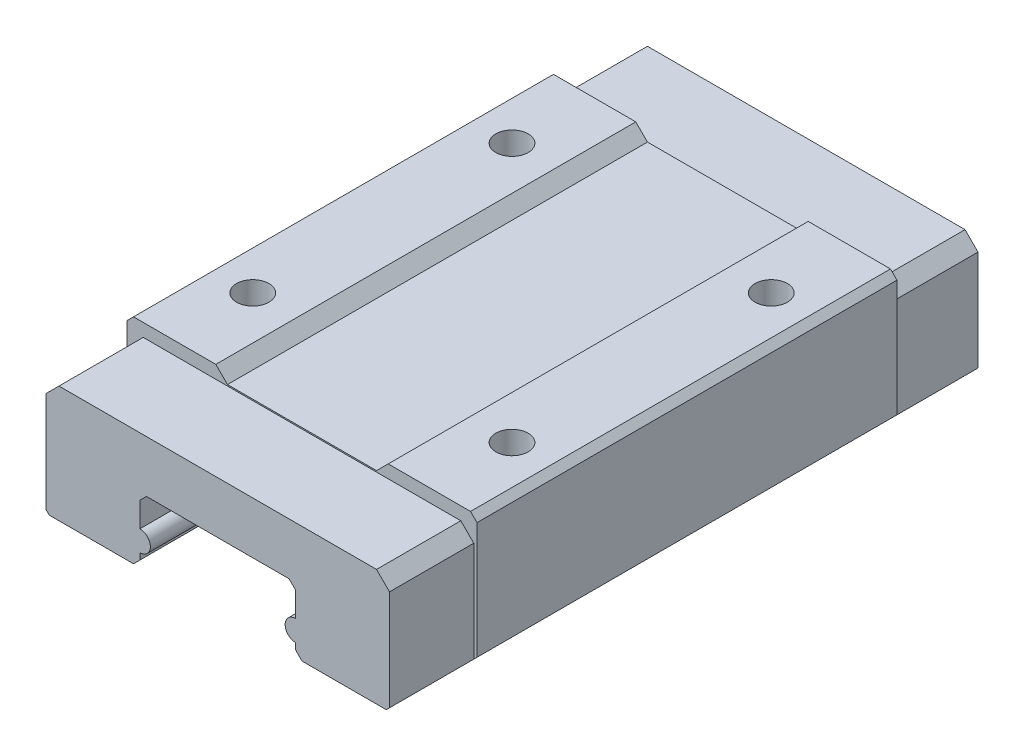
from build123d import *

# Parameters (mm, degrees)
MAINBLOCKSKETCH_W              = 26.5
MAINBLOCKSKETCH_H              = 45.4
MAINBLOCK_DEPTH                = 9
FACEDSURFACESKETCH_W           = 27
FACEDSURFACESKETCH_H           = 32.4
FACEDSURFACE_DEPTH             = 10
M3X0_5_TAPPED_HOLE1_D          = 2.5
M3X0_5_TAPPED_HOLE1_DEPTH      = 8.5
M3X0_5_TAPPED_HOLE1_TIP        = 0.751075774
RAIL_SLOT_DEPTH                = 29.240750698
RAIL_SLOT_DEPTH_BACK           = 29.240750698
INTERNAL_DIP_SKETCH_W          = 13.5
INTERNAL_DIP_SKETCH_H          = 32.4
INTERNAL_DIP_DEPTH             = 0.9
INTERNAL_CHAMFER_SIZE          = 0.5
COSMETIC_CHAMFERS_SIZE         = 1
SMALLER_COSMETIC_CHAMFERS_SIZE = 0.5


with BuildPart() as part:
    # MainBlockSketch → MainBlock (new body)
    with BuildSketch(Plane(origin=(0, 0, 0), x_dir=(1, 0, 0), z_dir=(0, 1, 0))):
        Rectangle(MAINBLOCKSKETCH_W, MAINBLOCKSKETCH_H)
    extrude(amount=MAINBLOCK_DEPTH)

    # FacedSurfaceSketch → FacedSurface (add)
    with BuildSketch(Plane(origin=(0, 0, 0), x_dir=(1, 0, 0), z_dir=(0, 1, 0))):
        Rectangle(FACEDSURFACESKETCH_W, FACEDSURFACESKETCH_H)
    extrude(amount=FACEDSURFACE_DEPTH)

    # M3x0.5 Tapped Hole1
    with Locations(Plane(origin=(0, 10, 0), x_dir=(1, 0, 0), z_dir=(0, 1, 0))):
        with Locations((-10, 10), (10, 10), (10, -10), (-10, -10)):
            Hole(M3X0_5_TAPPED_HOLE1_D / 2, depth=M3X0_5_TAPPED_HOLE1_DEPTH)
            with Locations((0, 0, -(M3X0_5_TAPPED_HOLE1_DEPTH + M3X0_5_TAPPED_HOLE1_TIP / 2))):  # 118° drill point
                Cone(0, M3X0_5_TAPPED_HOLE1_D / 2, M3X0_5_TAPPED_HOLE1_TIP, mode=Mode.SUBTRACT)

    # RailSlotSketch → Rail Slot (cut, two sides: drawn at the far end of the back side and taken through both)
    with BuildSketch(Plane.XY.offset(-RAIL_SLOT_DEPTH_BACK)):
        with BuildLine():
            Line((-6, 2.59), (-6, 5))
            Line((-6, 5), (6, 5))
            Line((6, 5), (6, 2.59))
            ThreePointArc((6, 2.59), (5.2, 1.79), (6, 0.99))
            Line((6, 0.99), (6, 0))
            Line((6, 0), (-6, 0))
            Line((-6, 0), (-6, 0.99))
            ThreePointArc((-6, 0.99), (-5.2, 1.79), (-6, 2.59))
        make_face()
    extrude(amount=RAIL_SLOT_DEPTH + RAIL_SLOT_DEPTH_BACK, mode=Mode.SUBTRACT)

    # Internal Dip Sketch → Internal Dip (cut)
    with BuildSketch(Plane(origin=(0, 10, 0), x_dir=(1, 0, 0), z_dir=(0, 1, 0))):
        Rectangle(INTERNAL_DIP_SKETCH_W, INTERNAL_DIP_SKETCH_H)
    extrude(amount=-INTERNAL_DIP_DEPTH, mode=Mode.SUBTRACT)

    # Internal Chamfer
    internal_chamfer_edges = [part.edges().sort_by_distance(p)[0] for p in [
        (6, 5, 0),
        (-6, 5, 0),
    ]]
    chamfer(internal_chamfer_edges, length=INTERNAL_CHAMFER_SIZE)

    # Cosmetic Chamfers
    # the kernel refuses this chamfer: 1 mm, written as the material it adds along each edge
    with BuildSketch(Plane(origin=(-6.75, 9.1, 16.2), x_dir=(0.9996219169112968, -0.027495876610585623, 0), z_dir=(0, 0, -1))) as cosmetic_chamfers_piece_1_section:
        Polygon((COSMETIC_CHAMFERS_SIZE * 0.999621916911, -COSMETIC_CHAMFERS_SIZE * 0.0274958766106), (-COSMETIC_CHAMFERS_SIZE * 0.0274958766106, -COSMETIC_CHAMFERS_SIZE * 0.999621916911), (0, 0), align=None)
    cosmetic_chamfers_piece_1 = extrude(amount=32.4, mode=Mode.PRIVATE)
    cosmetic_chamfers_piece_1 = split(cosmetic_chamfers_piece_1, bisect_by=Plane(origin=(-6.414099253, 10, 0), z_dir=(0, -1, 0)), keep=Keep.TOP, mode=Mode.PRIVATE)
    add(cosmetic_chamfers_piece_1)
    with BuildSketch(Plane(origin=(6.75, 9.1, -16.2), x_dir=(0.02749587661058651, 0.9996219169112968, 0), z_dir=(0, 0, 1))) as cosmetic_chamfers_piece_2_section:
        Polygon((COSMETIC_CHAMFERS_SIZE * 0.999621916911, COSMETIC_CHAMFERS_SIZE * 0.0274958766106), (-COSMETIC_CHAMFERS_SIZE * 0.0274958766106, COSMETIC_CHAMFERS_SIZE * 0.999621916911), (0, 0), align=None)
    cosmetic_chamfers_piece_2 = extrude(amount=32.4, mode=Mode.PRIVATE)
    cosmetic_chamfers_piece_2 = split(cosmetic_chamfers_piece_2, bisect_by=Plane(origin=(6.414099253, 10, 0), z_dir=(0, -1, 0)), keep=Keep.TOP, mode=Mode.PRIVATE)
    add(cosmetic_chamfers_piece_2)
    # the kernel refuses this chamfer: 1 mm, written as the material it takes off along each edge
    with BuildSketch(Plane(origin=(13.25, 9, 25.271682988), x_dir=(0.027495876610585623, -0.9996219169112968, 0), z_dir=(0, 0, -1))) as cosmetic_chamfers_2_piece_1:
        Polygon((COSMETIC_CHAMFERS_SIZE * 0.999621916911, COSMETIC_CHAMFERS_SIZE * 0.0274958766106), (-COSMETIC_CHAMFERS_SIZE * 0.0274958766106, COSMETIC_CHAMFERS_SIZE * 0.999621916911), (0, 0), align=None)
    extrude(amount=9.071682988, mode=Mode.SUBTRACT)
    with BuildSketch(Plane(origin=(-13.25, 9, 16.2), x_dir=(0.9996219169112968, 0.027495876610585647, 0), z_dir=(0, 0, 1)), Plane(origin=(-13.25, 9, -25.271682988), x_dir=(0.9996219169112968, 0.027495876610585647, 0), z_dir=(0, 0, 1)), Plane(origin=(13.25, 9, -16.2), x_dir=(-0.9996219169112968, 0.027495876610585647, 0), z_dir=(0, 0, -1))) as cosmetic_chamfers_2_piece_2:
        Polygon((COSMETIC_CHAMFERS_SIZE * 0.999621916911, -COSMETIC_CHAMFERS_SIZE * 0.0274958766106), (-COSMETIC_CHAMFERS_SIZE * 0.0274958766106, -COSMETIC_CHAMFERS_SIZE * 0.999621916911), (0, 0), align=None)
    extrude(amount=9.071682988, mode=Mode.SUBTRACT)

    # Smaller Cosmetic Chamfers
    smaller_cosmetic_chamfers_edges = [part.edges().sort_by_distance(p)[0] for p in [
        (13.5, 10, 0),
        (-13.5, 10, 0),
        (-13.5, 0, 0),
        (13.5, 0, 0),
        (6, 0, 0),
        (-6, 0, 0),
    ]]
    chamfer(smaller_cosmetic_chamfers_edges, length=SMALLER_COSMETIC_CHAMFERS_SIZE)


solid = part.part
